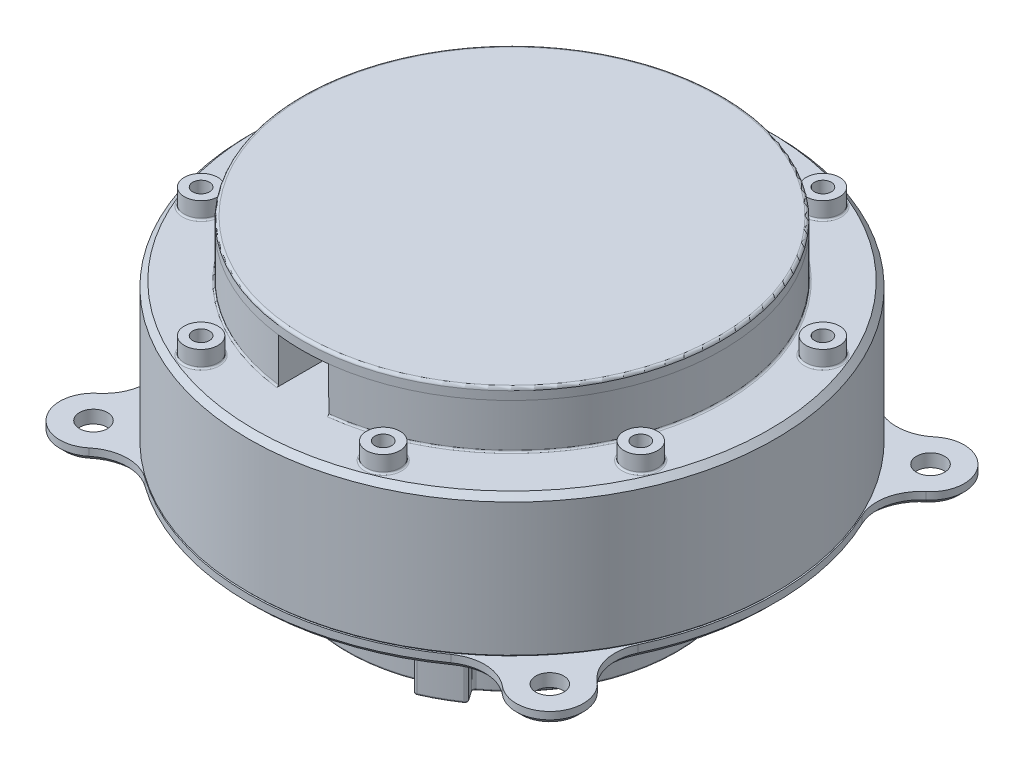
from build123d import *

# Parameters (mm, degrees)
SKETCH_1_R               = 47
SKETCH_1_R_2             = 1.5
EXTRUDE_1_DEPTH          = 25
SKETCH_2_R               = 3
SKETCH_2_R_2             = 1.5
EXTRUDE_2_DEPTH          = 3
EXTRUDE_3_DEPTH          = 8
SKETCH_4_R               = 37.505
EXTRUDE_4_DEPTH          = 2
FILLET_1_R               = 0.5
CHAMFER_1_SIZE           = 1
FILLET_2_R               = 0.3
CHAMFER_2_SIZE           = 0.3
EXTRUDE_START            = 2.3
SKETCH_5_R               = 2.5
EXTRUDE_5_DEPTH          = 2.3
SKETCH_16_R              = 40
CUT_EXTRUDE_5_DEPTH      = 1
CHAMFER_6_SIZE           = 1
SKETCH_6_R               = 27.5
EXTRUDE_6_DEPTH          = 16.5
SKETCH_7_R               = 27.5
SKETCH_7_R_2             = 22
EXTRUDE_7_DEPTH          = 7.5
SKETCH_8_R               = 21
EXTRUDE_8_DEPTH          = 7
SKETCH_9_R               = 20
EXTRUDE_9_DEPTH          = 10
SKETCH_10_R              = 9.75
CUT_EXTRUDE_1_DEPTH      = 5.5
CUT_EXTRUDE_2_DEPTH      = 5.6
SKETCH_12_R              = 1.5
CUT_EXTRUDE_3_DEPTH      = 6
SKETCH_13_R              = 2
EXTRUDE_10_DEPTH         = 2.6
CHAMFER_3_SIZE           = 0.5
CHAMFER_4_SIZE           = 0.2
FILLET_4_R               = 0.3
CUT_EXTRUDE_4_DEPTH      = 6
CUT_EXTRUDE_4_DEPTH_BACK = 26.3
SKETCH_15_R              = 19.25


with BuildPart() as part:
    # 草图1 → 凸台-拉伸1 (new body)
    with BuildSketch(Plane(origin=(0, 0, 0), x_dir=(1, 0, 0), z_dir=(0, 1, 0))):
        with Locations(Location((0, 0, 0), (0, 0, 270))):
            Circle(SKETCH_1_R)
        with Locations(Location((-16.264045876, 39.264880132, 0), (0, 0, 270))):
            Circle(SKETCH_1_R_2, mode=Mode.SUBTRACT)
        with Locations(Location((16.264045876, 39.264880132, 0), (0, 0, 270))):
            Circle(SKETCH_1_R_2, mode=Mode.SUBTRACT)
        with Locations(Location((39.264880132, 16.264045876, 0), (0, 0, 270))):
            Circle(SKETCH_1_R_2, mode=Mode.SUBTRACT)
        with Locations(Location((39.264880132, -16.264045876, 0), (0, 0, 270))):
            Circle(SKETCH_1_R_2, mode=Mode.SUBTRACT)
        with Locations(Location((16.264045876, -39.264880132, 0), (0, 0, 270))):
            Circle(SKETCH_1_R_2, mode=Mode.SUBTRACT)
        with Locations(Location((-16.264045876, -39.264880132, 0), (0, 0, 270))):
            Circle(SKETCH_1_R_2, mode=Mode.SUBTRACT)
        with Locations(Location((-39.264880132, -16.264045876, 0), (0, 0, 270))):
            Circle(SKETCH_1_R_2, mode=Mode.SUBTRACT)
        with Locations(Location((-39.264880132, 16.264045876, 0), (0, 0, 270))):
            Circle(SKETCH_1_R_2, mode=Mode.SUBTRACT)
    extrude(amount=EXTRUDE_1_DEPTH)

    # 草图2 → 凸台-拉伸2 (add)
    # profile 1 of 8: a face of its own
    with BuildSketch(Plane(origin=(0, 25, 0), x_dir=(1, 0, 0), z_dir=(0, 1, 0))):
        with Locations(Location((-16.264045876, 39.264880132, 0), (0, 0, 270))):
            Circle(SKETCH_2_R)
        with Locations(Location((-16.264045876, 39.264880132, 0), (0, 0, 270))):
            Circle(SKETCH_2_R_2, mode=Mode.SUBTRACT)
    # profile 2 of 8: a face of its own
    with BuildSketch(Plane(origin=(0, 25, 0), x_dir=(1, 0, 0), z_dir=(0, 1, 0))):
        with Locations(Location((16.264045876, 39.264880132, 0), (0, 0, 270))):
            Circle(SKETCH_2_R)
        with Locations(Location((16.264045876, 39.264880132, 0), (0, 0, 270))):
            Circle(SKETCH_2_R_2, mode=Mode.SUBTRACT)
    # profile 3 of 8: a face of its own
    with BuildSketch(Plane(origin=(0, 25, 0), x_dir=(1, 0, 0), z_dir=(0, 1, 0))):
        with Locations(Location((39.264880132, 16.264045876, 0), (0, 0, 270))):
            Circle(SKETCH_2_R)
        with Locations(Location((39.264880132, 16.264045876, 0), (0, 0, 270))):
            Circle(SKETCH_2_R_2, mode=Mode.SUBTRACT)
    # profile 4 of 8: a face of its own
    with BuildSketch(Plane(origin=(0, 25, 0), x_dir=(1, 0, 0), z_dir=(0, 1, 0))):
        with Locations(Location((39.264880132, -16.264045876, 0), (0, 0, 270))):
            Circle(SKETCH_2_R)
        with Locations(Location((39.264880132, -16.264045876, 0), (0, 0, 270))):
            Circle(SKETCH_2_R_2, mode=Mode.SUBTRACT)
    # profile 5 of 8: a face of its own
    with BuildSketch(Plane(origin=(0, 25, 0), x_dir=(1, 0, 0), z_dir=(0, 1, 0))):
        with Locations(Location((16.264045876, -39.264880132, 0), (0, 0, 270))):
            Circle(SKETCH_2_R)
        with Locations(Location((16.264045876, -39.264880132, 0), (0, 0, 270))):
            Circle(SKETCH_2_R_2, mode=Mode.SUBTRACT)
    # profile 6 of 8: a face of its own
    with BuildSketch(Plane(origin=(0, 25, 0), x_dir=(1, 0, 0), z_dir=(0, 1, 0))):
        with Locations(Location((-16.264045876, -39.264880132, 0), (0, 0, 270))):
            Circle(SKETCH_2_R)
        with Locations(Location((-16.264045876, -39.264880132, 0), (0, 0, 270))):
            Circle(SKETCH_2_R_2, mode=Mode.SUBTRACT)
    # profile 7 of 8: a face of its own
    with BuildSketch(Plane(origin=(0, 25, 0), x_dir=(1, 0, 0), z_dir=(0, 1, 0))):
        with Locations(Location((-39.264880132, -16.264045876, 0), (0, 0, 270))):
            Circle(SKETCH_2_R)
        with Locations(Location((-39.264880132, -16.264045876, 0), (0, 0, 270))):
            Circle(SKETCH_2_R_2, mode=Mode.SUBTRACT)
    # profile 8 of 8: a face of its own
    with BuildSketch(Plane(origin=(0, 25, 0), x_dir=(1, 0, 0), z_dir=(0, 1, 0))):
        with Locations(Location((-39.264880132, 16.264045876, 0), (0, 0, 270))):
            Circle(SKETCH_2_R)
        with Locations(Location((-39.264880132, 16.264045876, 0), (0, 0, 270))):
            Circle(SKETCH_2_R_2, mode=Mode.SUBTRACT)
    extrude(amount=EXTRUDE_2_DEPTH)

    # 草图3 → 凸台-拉伸3 (add)
    with BuildSketch(Plane(origin=(0, 25, 0), x_dir=(1, 0, 0), z_dir=(0, 1, 0))):
        with BuildLine():
            Line((-4.5, -37.229020938), (-4.5, 0))
            Line((-4.5, 0), (4.5, 0))
            Line((4.5, 0), (4.5, -37.229020938))
            ThreePointArc((4.5, -37.229020938), (28.062430401, -24.874685928), (37.5, 0))
            ThreePointArc((37.5, 0), (-24.874685928, 28.062430401), (-4.5, -37.229020938))
        make_face()
    extrude(amount=EXTRUDE_3_DEPTH)

    # 草图4 → 凸台-拉伸4 (add)
    with BuildSketch(Plane(origin=(0, 33, 0), x_dir=(1, 0, 0), z_dir=(0, 1, 0))):
        with Locations(Location((0, 0, 0), (0, 0, 263.108169794))):
            Circle(SKETCH_4_R)
    extrude(amount=EXTRUDE_4_DEPTH)

    # 圆角1
    fillet_1_edges = [part.edges().sort_by_distance(p)[0] for p in [
        (4.500422997, 35, -37.234006202),
    ]]
    fillet(fillet_1_edges, radius=FILLET_1_R)

    # 倒角1
    chamfer_1_edges = [part.edges().sort_by_distance(p)[0] for p in [
        (0, 25, -47),
    ]]
    chamfer(chamfer_1_edges, length=CHAMFER_1_SIZE)

    # 圆角2
    fillet_2_edges = [part.edges().sort_by_distance(p)[0] for p in [
        (-16.264045876, 25, -42.264880132),
        (16.264045876, 25, -42.264880132),
        (39.264880132, 25, -19.264045876),
        (39.264880132, 25, 13.264045876),
        (16.264045876, 25, 36.264880132),
        (-16.264045876, 25, 36.264880132),
        (-39.264880132, 25, 13.264045876),
        (-39.264880132, 25, -19.264045876),
        (0, 25, -37.5),
    ]]
    fillet(fillet_2_edges, radius=FILLET_2_R)

    # 倒角2
    chamfer_2_edges = [part.edges().sort_by_distance(p)[0] for p in [
        (0, 0, -47),
    ]]
    chamfer(chamfer_2_edges, length=CHAMFER_2_SIZE)

    # 草图5 → 凸台-拉伸5 (add)
    with BuildSketch(Plane.XZ.offset(EXTRUDE_START)):
        with BuildLine():
            ThreePointArc((44.593885752, 29.392989871), (41.958783906, 25.06173547), (42.521429039, 20.023188369))
            ThreePointArc((42.521429039, 20.023188369), (47, 0), (42.521429039, -20.023188369))
            ThreePointArc((42.521429039, -20.023188369), (41.958783906, -25.06173547), (44.593885752, -29.392989871))
            ThreePointArc((44.593885752, -29.392989871), (45.357010129, -37.843885752), (36.906114248, -38.607010129))
            ThreePointArc((36.906114248, -38.607010129), (32.17286955, -36.790441647), (27.316622128, -38.246596653))
            ThreePointArc((27.316622128, -38.246596653), (0, -47), (-27.316622128, -38.246596653))
            ThreePointArc((-27.316622128, -38.246596653), (-32.17286955, -36.790441647), (-36.906114248, -38.607010129))
            ThreePointArc((-36.906114248, -38.607010129), (-45.357010129, -37.843885752), (-44.593885752, -29.392989871))
            ThreePointArc((-44.593885752, -29.392989871), (-41.958783906, -25.06173547), (-42.521429039, -20.023188369))
            ThreePointArc((-42.521429039, -20.023188369), (-47, 0), (-42.521429039, 20.023188369))
            ThreePointArc((-42.521429039, 20.023188369), (-41.958783906, 25.06173547), (-44.593885752, 29.392989871))
            ThreePointArc((-44.593885752, 29.392989871), (-45.357010129, 37.843885752), (-36.906114248, 38.607010129))
            ThreePointArc((-36.906114248, 38.607010129), (-32.17286955, 36.790441647), (-27.316622128, 38.246596653))
            ThreePointArc((-27.316622128, 38.246596653), (0, 47), (27.316622128, 38.246596653))
            ThreePointArc((27.316622128, 38.246596653), (32.17286955, 36.790441647), (36.906114248, 38.607010129))
            ThreePointArc((36.906114248, 38.607010129), (45.357010129, 37.843885752), (44.593885752, 29.392989871))
        make_face()
        with Locations(Location((40.75, 34, 0), (0, 0, 270))):
            Circle(SKETCH_5_R, mode=Mode.SUBTRACT)
        with Locations(Location((40.75, -34, 0), (0, 0, 270))):
            Circle(SKETCH_5_R, mode=Mode.SUBTRACT)
        with Locations(Location((-40.75, 34, 0), (0, 0, 270))):
            Circle(SKETCH_5_R, mode=Mode.SUBTRACT)
        with Locations(Location((-40.75, -34, 0), (0, 0, 270))):
            Circle(SKETCH_5_R, mode=Mode.SUBTRACT)
    extrude(amount=-EXTRUDE_5_DEPTH)

    # 草图16 → 切除-拉伸5 (cut)
    with BuildSketch(Plane.XZ.offset(2.3)):
        with Locations(Location((0, 0, 0), (0, 0, 270))):
            Circle(SKETCH_16_R)
    extrude(amount=-CUT_EXTRUDE_5_DEPTH, mode=Mode.SUBTRACT)

    # 倒角6
    chamfer_6_edges = [part.edges().sort_by_distance(p)[0] for p in [
        (0, -2.3, 47),
        (-32.17286955, -2.3, 36.790441647),
        (-45.357010129, -2.3, 37.843885752),
        (-41.958783906, -2.3, 25.06173547),
        (-47, -2.3, 0),
        (-41.958783906, -2.3, -25.06173547),
        (-45.357010129, -2.3, -37.843885752),
        (-32.17286955, -2.3, -36.790441647),
        (0, -2.3, -47),
        (32.17286955, -2.3, -36.790441647),
        (45.357010129, -2.3, -37.843885752),
        (41.958783906, -2.3, -25.06173547),
        (47, -2.3, 0),
        (41.958783906, -2.3, 25.06173547),
        (45.357010129, -2.3, 37.843885752),
        (32.17286955, -2.3, 36.790441647),
        (0, -2.3, 40),
    ]]
    chamfer(chamfer_6_edges, length=CHAMFER_6_SIZE - 0.0001)  # a hair under: the kernel refuses the full size

    # 草图6 → 凸台-拉伸6 (add)
    with BuildSketch(Plane.XZ.offset(1.3)):
        with BuildLine():
            Line((-17.285734297, 24.514350692), (-18.438426769, 26.149080639))
            ThreePointArc((-18.438426769, 26.149080639), (-18.521803962, 26.526264763), (-18.311513086, 26.850297736))
            ThreePointArc((-18.311513086, 26.850297736), (-15.6585851, 28.479092553), (-12.861990995, 29.846594239))
            ThreePointArc((-12.861990995, 29.846594239), (-12.475721862, 29.850566298), (-12.201900068, 29.578093832))
            Line((-12.201900068, 29.578093832), (-11.439088873, 27.72899648))
            ThreePointArc((-11.439088873, 27.72899648), (-11.172720472, 27.459626138), (-10.793926818, 27.454346538))
            ThreePointArc((-10.793926818, 27.454346538), (0, 29.5), (10.793926818, 27.454346538))
            ThreePointArc((10.793926818, 27.454346538), (11.172720472, 27.459626138), (11.439088873, 27.72899648))
            Line((11.439088873, 27.72899648), (12.201900068, 29.578093832))
            ThreePointArc((12.201900068, 29.578093832), (12.475721862, 29.850566298), (12.861990995, 29.846594239))
            ThreePointArc((12.861990995, 29.846594239), (15.6585851, 28.479092553), (18.311513086, 26.850297736))
            ThreePointArc((18.311513086, 26.850297736), (18.521803962, 26.526264763), (18.438426769, 26.149080639))
            Line((18.438426769, 26.149080639), (17.285734297, 24.514350692))
            ThreePointArc((17.285734297, 24.514350692), (17.200983475, 24.14512203), (17.399457507, 23.822444847))
            ThreePointArc((17.399457507, 23.822444847), (29.5, 0), (17.399457507, -23.822444847))
            ThreePointArc((17.399457507, -23.822444847), (17.200983475, -24.14512203), (17.285734297, -24.514350692))
            Line((17.285734297, -24.514350692), (18.438426769, -26.149080639))
            ThreePointArc((18.438426769, -26.149080639), (18.521803962, -26.526264763), (18.311513086, -26.850297736))
            ThreePointArc((18.311513086, -26.850297736), (15.6585851, -28.479092553), (12.861990995, -29.846594239))
            ThreePointArc((12.861990995, -29.846594239), (12.475721862, -29.850566298), (12.201900068, -29.578093832))
            Line((12.201900068, -29.578093832), (11.439088873, -27.72899648))
            ThreePointArc((11.439088873, -27.72899648), (11.172720472, -27.459626138), (10.793926818, -27.454346538))
            ThreePointArc((10.793926818, -27.454346538), (0, -29.5), (-10.793926818, -27.454346538))
            ThreePointArc((-10.793926818, -27.454346538), (-11.172720472, -27.459626138), (-11.439088873, -27.72899648))
            Line((-11.439088873, -27.72899648), (-12.201900068, -29.578093832))
            ThreePointArc((-12.201900068, -29.578093832), (-12.475721862, -29.850566298), (-12.861990995, -29.846594239))
            ThreePointArc((-12.861990995, -29.846594239), (-15.6585851, -28.479092553), (-18.311513086, -26.850297736))
            ThreePointArc((-18.311513086, -26.850297736), (-18.521803962, -26.526264763), (-18.438426769, -26.149080639))
            Line((-18.438426769, -26.149080639), (-17.285734297, -24.514350692))
            ThreePointArc((-17.285734297, -24.514350692), (-17.200983475, -24.14512203), (-17.399457507, -23.822444847))
            ThreePointArc((-17.399457507, -23.822444847), (-29.5, 0), (-17.399457507, 23.822444847))
            ThreePointArc((-17.399457507, 23.822444847), (-17.200983475, 24.14512203), (-17.285734297, 24.514350692))
        make_face()
        with Locations(Location((0, 0, 0), (0, 0, 270))):
            Circle(SKETCH_6_R, mode=Mode.SUBTRACT)
    extrude(amount=EXTRUDE_6_DEPTH)

    # 草图7 → 凸台-拉伸7 (add)
    with BuildSketch(Plane.XZ.offset(1.3)):
        with Locations(Location((0, 0, 0), (0, 0, 90))):
            Circle(SKETCH_7_R)
        with Locations(Location((0, 0, 0), (0, 0, 90))):
            Circle(SKETCH_7_R_2, mode=Mode.SUBTRACT)
    extrude(amount=EXTRUDE_7_DEPTH)

    # 草图8 → 凸台-拉伸8 (add)
    with BuildSketch(Plane.XZ.offset(1.3)):
        with Locations(Location((0, 0, 0), (0, 0, 90))):
            Circle(SKETCH_8_R)
    extrude(amount=EXTRUDE_8_DEPTH)

    # 草图9 → 凸台-拉伸9 (add)
    with BuildSketch(Plane.XZ.offset(8.3)):
        with Locations(Location((0, 0, 0), (0, 0, 270))):
            Circle(SKETCH_9_R)
    extrude(amount=EXTRUDE_9_DEPTH)

    # 草图10 → 切除-拉伸1 (cut)
    with BuildSketch(Plane.XZ.offset(18.3)):
        with Locations(Location((0, 0, 0), (0, 0, 270))):
            Circle(SKETCH_10_R)
    extrude(amount=-CUT_EXTRUDE_1_DEPTH, mode=Mode.SUBTRACT)

    # 草图11 → 切除-拉伸2 (cut)
    with BuildSketch(Plane.XZ.offset(18.3)):
        with BuildLine():
            Line((0, 12.961481397), (0, 15.968719423))
            ThreePointArc((0, 15.968719423), (0.315346803, 16.69758841), (1.0625, 16.966764387))
            ThreePointArc((1.0625, 16.966764387), (4.958333333, 16.260840401), (8.585218328, 14.672901085))
            ThreePointArc((8.585218328, 14.672901085), (9.055059586, 14.03263333), (8.910066596, 13.251819243))
            Line((8.910066596, 13.251819243), (7.232117953, 10.756229354))
            ThreePointArc((7.232117953, 10.756229354), (6.632142436, 10.340981707), (5.909775547, 10.443876339))
            ThreePointArc((5.909775547, 10.443876339), (3.5, 11.478240283), (0.923076923, 11.964444366))
            ThreePointArc((0.923076923, 11.964444366), (0.266200614, 12.282115176), (0, 12.961481397))
        make_face()
        with BuildLine():
            Line((5.699108892, -11.641312548), (7.021378813, -14.342253643))
            ThreePointArc((7.021378813, -14.342253643), (7.625087153, -14.8582283), (8.414495923, -14.771467712))
            ThreePointArc((8.414495923, -14.771467712), (11.603134208, -12.424462828), (14.162398979, -9.403534185))
            ThreePointArc((14.162398979, -9.403534185), (14.302862343, -8.621892547), (13.829316686, -7.984359711))
            Line((13.829316686, -7.984359711), (11.22497216, -6.480740698))
            ThreePointArc((11.22497216, -6.480740698), (10.503523448, -6.371594083), (9.899974302, -6.781630248))
            ThreePointArc((9.899974302, -6.781630248), (8.190447676, -8.770209055), (6.08977445, -10.339953924))
            ThreePointArc((6.08977445, -10.339953924), (5.63948164, -10.914094685), (5.699108892, -11.641312548))
        make_face()
        with BuildLine():
            Line((-12.931226846, 0.885083194), (-15.931445409, 1.0904344))
            ThreePointArc((-15.931445409, 1.0904344), (-16.680146739, 0.825594969), (-16.999714251, 0.098566626))
            ThreePointArc((-16.999714251, 0.098566626), (-16.561467541, -3.836377574), (-15.224898979, -7.563230202))
            ThreePointArc((-15.224898979, -7.563230202), (-14.618209146, -8.075695862), (-13.829316686, -7.984359711))
            Line((-13.829316686, -7.984359711), (-11.22497216, -6.480740698))
            ThreePointArc((-11.22497216, -6.480740698), (-10.769724062, -5.910521094), (-10.823051225, -5.182814118))
            ThreePointArc((-10.823051225, -5.182814118), (-11.690447676, -2.708031228), (-11.999549997, -0.103922415))
            ThreePointArc((-11.999549997, -0.103922415), (-12.271624077, 0.573112978), (-12.931226846, 0.885083194))
        make_face()
    extrude(amount=-CUT_EXTRUDE_2_DEPTH, mode=Mode.SUBTRACT)

    # 草图12 → 切除-拉伸3 (cut)
    with BuildSketch(Plane.XZ.offset(18.3)):
        with Locations(Location((-3.061820011, 13.217737762, 0), (0, 0, 270))):
            Circle(SKETCH_12_R)
        with Locations(Location((9.915986677, 9.260482792, 0), (0, 0, 270))):
            Circle(SKETCH_12_R)
        with Locations(Location((12.977806688, -3.95725497, 0), (0, 0, 270))):
            Circle(SKETCH_12_R)
        with Locations(Location((3.061820011, -13.217737762, 0), (0, 0, 270))):
            Circle(SKETCH_12_R)
        with Locations(Location((-9.915986677, -9.260482792, 0), (0, 0, 270))):
            Circle(SKETCH_12_R)
        with Locations(Location((-12.977806688, 3.95725497, 0), (0, 0, 270))):
            Circle(SKETCH_12_R)
    extrude(amount=-CUT_EXTRUDE_3_DEPTH, mode=Mode.SUBTRACT)

    # 草图13 → 凸台-拉伸10 (add)
    with BuildSketch(Plane.XZ.offset(18.3)):
        with Locations(Location((-9.457514341, 10.126965117, 0), (0, 0, 270))):
            Circle(SKETCH_13_R)
        with Locations(Location((13.498966225, 3.126965117, 0), (0, 0, 270))):
            Circle(SKETCH_13_R)
        with Locations(Location((-4.041451884, -13.253930235, 0), (0, 0, 270))):
            Circle(SKETCH_13_R)
    extrude(amount=EXTRUDE_10_DEPTH)

    # 倒角3
    chamfer_3_edges = [part.edges().sort_by_distance(p)[0] for p in [
        (0, -18.3, 20),
    ]]
    chamfer(chamfer_3_edges, length=CHAMFER_3_SIZE)

    # 倒角4
    chamfer_4_edges = [part.edges().sort_by_distance(p)[0] for p in [
        (0, -18.3, 9.75),
        (9.055059586, -18.3, 14.03263333),
        (4.958333333, -18.3, 16.260840401),
        (0.315346803, -18.3, 16.69758841),
        (0, -18.3, 14.46510041),
        (0.266200614, -18.3, 12.282115176),
        (3.5, -18.3, 11.478240283),
        (6.632142436, -18.3, 10.340981707),
        (8.071092275, -18.3, 12.004024298),
        (7.625087153, -18.3, -14.8582283),
        (11.603134208, -18.3, -12.424462828),
        (14.302862343, -18.3, -8.621892547),
        (12.527144423, -18.3, -7.232550205),
        (10.503523448, -18.3, -6.371594083),
        (8.190447676, -18.3, -8.770209055),
        (5.63948164, -18.3, -10.914094685),
        (6.360243853, -18.3, -12.991783095),
        (-16.680146739, -18.3, 0.825594969),
        (-16.561467541, -18.3, -3.836377574),
        (-14.618209146, -18.3, -8.075695862),
        (-12.527144423, -18.3, -7.232550205),
        (-10.769724062, -18.3, -5.910521094),
        (-11.690447676, -18.3, -2.708031228),
        (-12.271624077, -18.3, 0.573112978),
        (-14.431336127, -18.3, 0.987758797),
        (-3.061820011, -18.3, 14.717737762),
        (9.915986677, -18.3, 10.760482792),
        (12.977806688, -18.3, -2.45725497),
        (3.061820011, -18.3, -11.717737762),
        (-9.915986677, -18.3, -7.760482792),
        (-12.977806688, -18.3, 5.45725497),
        (13.498966225, -20.9, 5.126965117),
        (-9.457514341, -20.9, 12.126965117),
        (-4.041451884, -20.9, -11.253930235),
    ]]
    chamfer(chamfer_4_edges, length=CHAMFER_4_SIZE)

    # 圆角4
    fillet_4_edges = [part.edges().sort_by_distance(p)[0] for p in [
        (18.521803962, -17.8, 26.526264763),
        (15.6585851, -17.8, 28.479092553),
        (12.475721862, -17.8, 29.850566298),
        (11.82049447, -17.8, 28.653545156),
        (11.172720472, -17.8, 27.459626138),
        (0, -17.8, 29.5),
        (-11.172720472, -17.8, 27.459626138),
        (-11.82049447, -17.8, 28.653545156),
        (-12.475721862, -17.8, 29.850566298),
        (-15.6585851, -17.8, 28.479092553),
        (-18.521803962, -17.8, 26.526264763),
        (-17.862080533, -17.8, 25.331715665),
        (-17.200983475, -17.8, 24.14512203),
        (-29.5, -17.8, 0),
        (-17.200983475, -17.8, -24.14512203),
        (-17.862080533, -17.8, -25.331715665),
        (-18.521803962, -17.8, -26.526264763),
        (-15.6585851, -17.8, -28.479092553),
        (-12.475721862, -17.8, -29.850566298),
        (-11.82049447, -17.8, -28.653545156),
        (-11.172720472, -17.8, -27.459626138),
        (0, -17.8, -29.5),
        (11.172720472, -17.8, -27.459626138),
        (11.82049447, -17.8, -28.653545156),
        (12.475721862, -17.8, -29.850566298),
        (15.6585851, -17.8, -28.479092553),
        (18.521803962, -17.8, -26.526264763),
        (17.862080533, -17.8, -25.331715665),
        (17.200983475, -17.8, -24.14512203),
        (29.5, -17.8, 0),
        (17.200983475, -17.8, 24.14512203),
        (17.862080533, -17.8, 25.331715665),
        (18.521803962, -1.3, 26.526264763),
        (15.6585851, -1.3, 28.479092553),
        (12.475721862, -1.3, 29.850566298),
        (11.82049447, -1.3, 28.653545156),
        (11.172720472, -1.3, 27.459626138),
        (0, -1.3, 29.5),
        (-11.172720472, -1.3, 27.459626138),
        (-11.82049447, -1.3, 28.653545156),
        (-12.475721862, -1.3, 29.850566298),
        (-15.6585851, -1.3, 28.479092553),
        (-18.521803962, -1.3, 26.526264763),
        (-17.862080533, -1.3, 25.331715665),
        (-17.200983475, -1.3, 24.14512203),
        (-29.5, -1.3, 0),
        (-17.200983475, -1.3, -24.14512203),
        (-17.862080533, -1.3, -25.331715665),
        (-18.521803962, -1.3, -26.526264763),
        (-15.6585851, -1.3, -28.479092553),
        (-12.475721862, -1.3, -29.850566298),
        (-11.82049447, -1.3, -28.653545156),
        (-11.172720472, -1.3, -27.459626138),
        (0, -1.3, -29.5),
        (11.172720472, -1.3, -27.459626138),
        (11.82049447, -1.3, -28.653545156),
        (12.475721862, -1.3, -29.850566298),
        (15.6585851, -1.3, -28.479092553),
        (18.521803962, -1.3, -26.526264763),
        (17.862080533, -1.3, -25.331715665),
        (17.200983475, -1.3, -24.14512203),
        (29.5, -1.3, 0),
        (17.200983475, -1.3, 24.14512203),
        (17.862080533, -1.3, 25.331715665),
        (0, -17.8, 27.5),
        (0, -8.8, 27.5),
        (0, -8.3, 20),
    ]]
    fillet(fillet_4_edges, radius=FILLET_4_R)

    # 草图15 → 切除-拉伸4 (cut, two sides: drawn at the far end of the back side and taken through both)
    with BuildSketch(Plane.XZ.offset(1.3).offset(-CUT_EXTRUDE_4_DEPTH_BACK)):
        with Locations(Location((0, 0, 0), (0, 0, 103.51890764))):
            Circle(SKETCH_15_R)
    extrude(amount=CUT_EXTRUDE_4_DEPTH + CUT_EXTRUDE_4_DEPTH_BACK, mode=Mode.SUBTRACT)


solid = part.part
